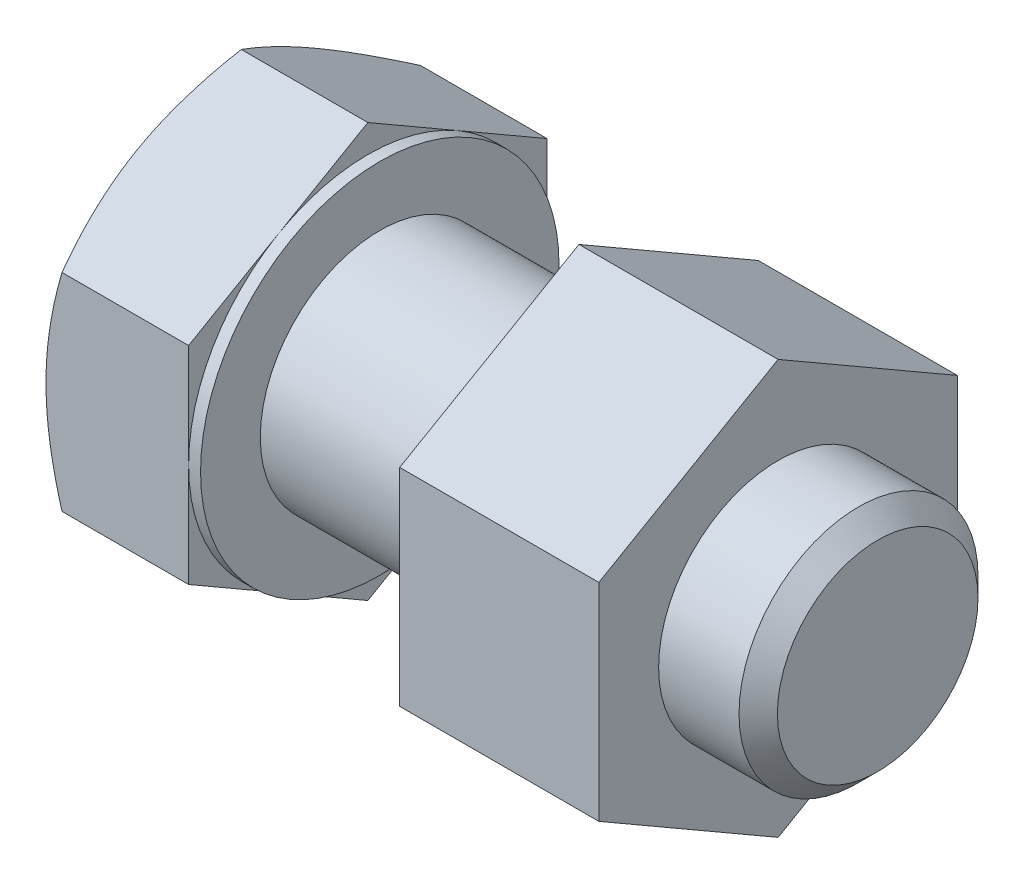
from build123d import *

# Parameters (mm, degrees)
BASEHEAD_DEPTH      = 7.76
SKETCH4_W           = 0.6
SKETCH4_H           = 11.392304845
BOSS_EXTRUDE1_DEPTH = 10


# Read off the part's stored shape, not the designer's step: HeadChamfer
with BuildPart() as part:
    # Sketch1 → BaseHead (new body)
    with BuildSketch(Plane(origin=(0, 0, 0), x_dir=(0, 0, -1), z_dir=(1, 0, 0))):
        Polygon((9, 5.196152423), (9, -5.196152423), (0, -10.392304845), (-9, -5.196152423), (-9, 5.196152423), (0, 10.392304845), align=None)
    extrude(amount=BASEHEAD_DEPTH)

    # HeadChamfer outline → HeadChamfer (revolve, cut)
    with BuildSketch(Plane.YX):
        Polygon((10.392304847, 0.803847578), (9, 0), (10.392304847, 0), align=None)
    revolve(axis=Axis((0, 0, 0), (1, 0, 0)), mode=Mode.SUBTRACT)

    # HeadChamfer 2 outline → HeadChamfer 2 (revolve)
    with BuildSketch(Plane.YX):
        Polygon((6, 7.76), (6, 31.796), (5.036, 32.76), (0, 32.76), (0, 7.76), align=None)
    revolve(axis=Axis((0, 0, 0), (1, 0, 0)))

    # Sketch4 → BearingFace (revolve, cut)
    with BuildSketch(Plane.XY, mode=Mode.PRIVATE) as bearingface_sk:
        with Locations((7.46, 14.696152423)):
            Rectangle(SKETCH4_W, SKETCH4_H)
    revolve(bearingface_sk.sketch.rotate(Axis((0, 0, 0), (1, 0, 0)), 90), axis=Axis((0, 0, 0), (1, 0, 0)), mode=Mode.SUBTRACT)

    # Sketch5 → Boss-Extrude1 (add)
    with BuildSketch(Plane(origin=(27.76, 0, 0), x_dir=(0, 0, -1), z_dir=(1, 0, 0))):
        Polygon((0, 10.392304845), (-9, 5.196152423), (-9, -5.196152423), (0, -10.392304845), (9, -5.196152423), (9, 5.196152423), align=None)
    extrude(amount=-BOSS_EXTRUDE1_DEPTH)


solid = part.part
